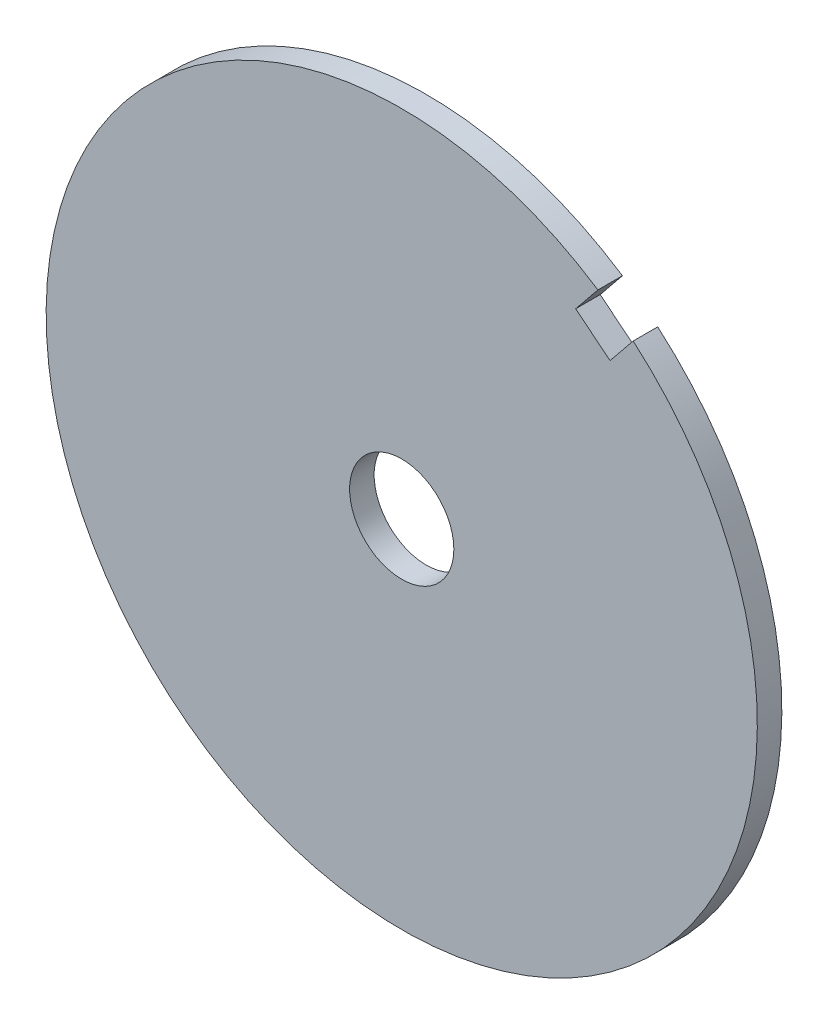
from build123d import *

# Parameters (mm, degrees)
SKETCH1_R               = 92.075
BOSS_EXTRUDE1_DEPTH     = 6.35
CUT_EXTRUDE1_REACH      = 132.368
SKETCH2_R               = 13.49375
CUT_EXTRUDE2_DEPTH      = 131.368453815
CUT_EXTRUDE2_DEPTH_BACK = 131.368453815


with BuildPart() as part:
    # Sketch1 → Boss-Extrude1 (new body)
    with BuildSketch(Plane.XY.offset(3372.777793208)):
        Circle(SKETCH1_R)
    extrude(amount=BOSS_EXTRUDE1_DEPTH)

    # Sketch2 → Cut-Extrude1 (cut, up to next)
    with BuildSketch(Plane.XY.offset(3379.127793208), mode=Mode.PRIVATE) as cut_extrude1_sk1:
        Circle(SKETCH2_R)
    cut_extrude1_tool1 = extrude(cut_extrude1_sk1.sketch, amount=-CUT_EXTRUDE1_REACH, mode=Mode.PRIVATE) & part.part
    add(cut_extrude1_tool1.solids().sort_by_distance((0, 0, 3379.127793))[0], mode=Mode.SUBTRACT)

    # Sketch3 → Cut-Extrude2 (cut, two sides: drawn at the far end of the back side and taken through both)
    with BuildSketch(Plane.XY.offset(3379.127793208).offset(-CUT_EXTRUDE2_DEPTH_BACK)):
        Polygon((336.833006413, 429.691727629), (50.799547549, 76.793304355), (45.050758965, 69.700643115), (53.930312859, 62.503531011), (59.927906279, 69.903159256), (345.961365143, 422.80158253), (893.301856889, 1147.941660755), (884.173498159, 1154.831805854), align=None)
    extrude(amount=CUT_EXTRUDE2_DEPTH + CUT_EXTRUDE2_DEPTH_BACK, mode=Mode.SUBTRACT)


solid = part.part
